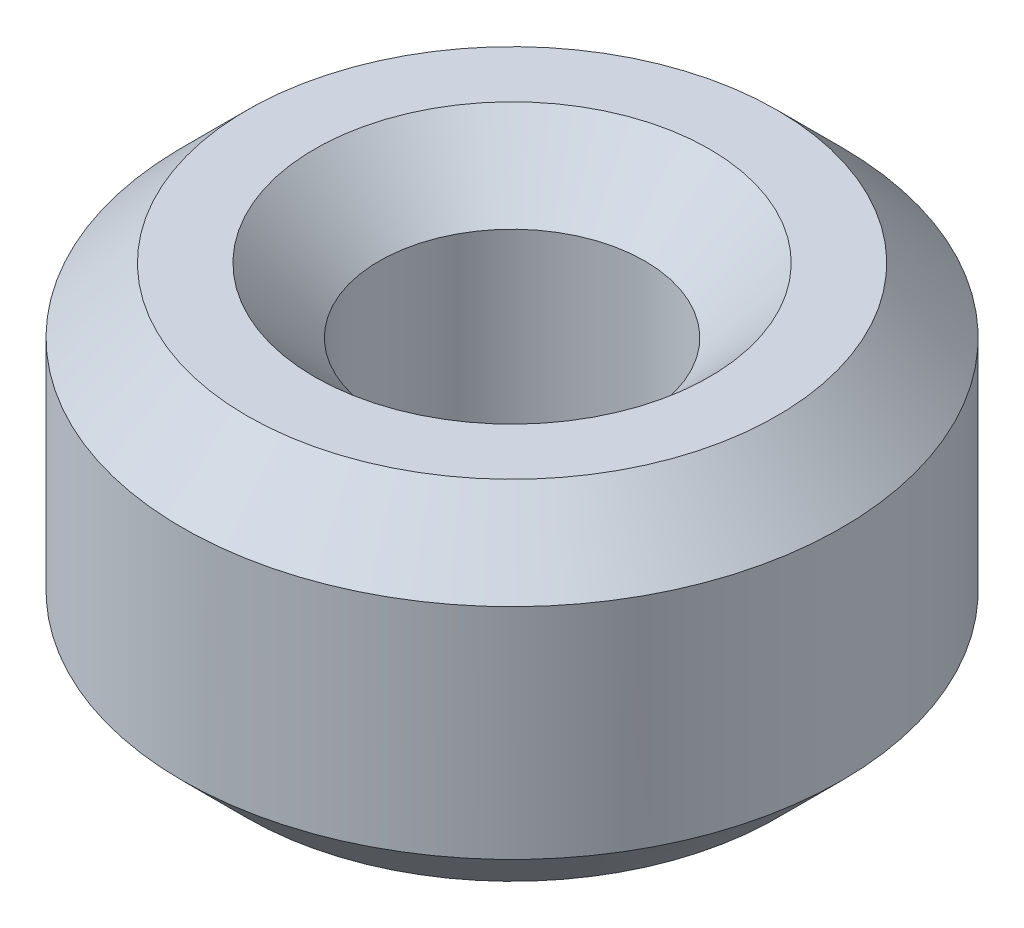
from build123d import *

# Parameters (mm, degrees)
SKETCH1_R           = 17.5
BOSS_EXTRUDE1_DEPTH = 18.488683143
SKETCH2_R           = 7.050195526
CUT_EXTRUDE1_DEPTH  = 31.892254763
CHAMFER1_SIZE       = 3.431777186


with BuildPart() as part:
    # Sketch1 → Boss-Extrude1 (new body)
    with BuildSketch(Plane(origin=(0, 0, 0), x_dir=(1, 0, 0), z_dir=(0, 1, 0))):
        Circle(SKETCH1_R)
    extrude(amount=BOSS_EXTRUDE1_DEPTH)

    # Sketch2 → Cut-Extrude1 (cut, through all)
    with BuildSketch(Plane(origin=(0, 0, 0), x_dir=(1, 0, 0), z_dir=(0, 1, 0))):
        Circle(SKETCH2_R)
    extrude(amount=CUT_EXTRUDE1_DEPTH, mode=Mode.SUBTRACT)

    # Chamfer1
    chamfer1_edges = [part.edges().sort_by_distance(p)[0] for p in [
        (-7.050195526, 18.488683143, 0),
        (-7.050195526, 0, 0),
        (-17.5, 0, 0),
        (-17.5, 18.488683143, 0),
    ]]
    chamfer(chamfer1_edges, length=CHAMFER1_SIZE)


solid = part.part
